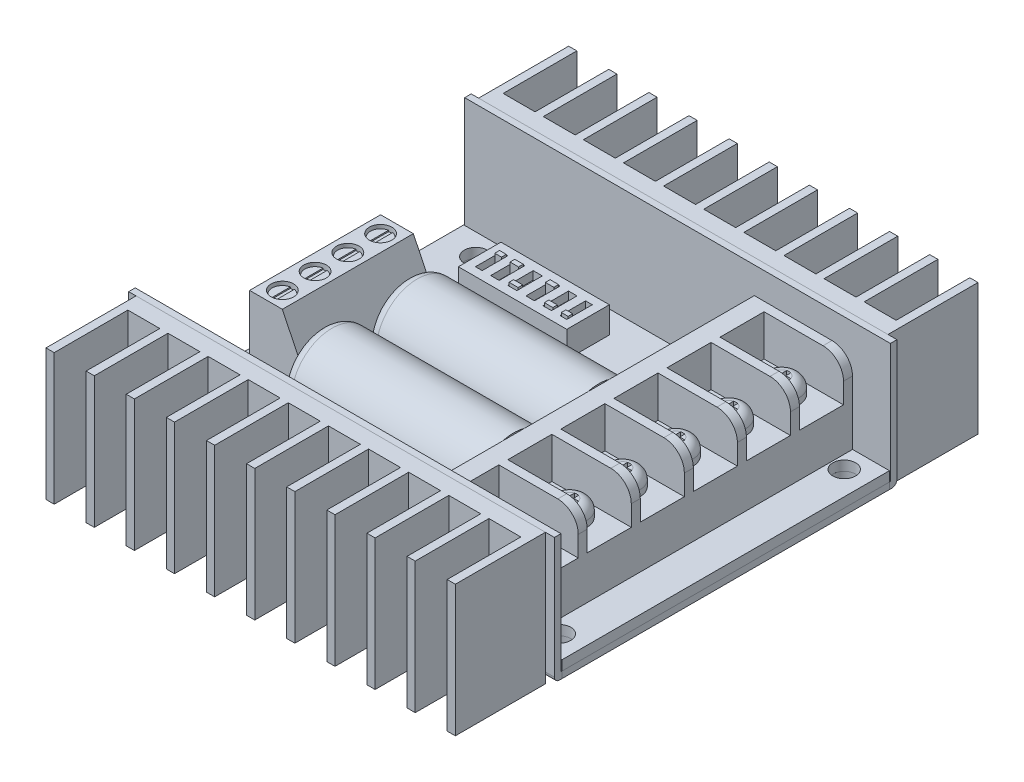
from build123d import *

# Parameters (mm, degrees)
SKETCH1_W              = 66.04
SKETCH1_H              = 50.8
BOSS_EXTRUDE1_DEPTH    = 0.762
SKETCH2_W              = 15.24
SKETCH2_H              = 50.8
BOSS_EXTRUDE2_DEPTH    = 6.6929
SKETCH7_W              = 2.921
SKETCH7_H              = 50.8
BOSS_EXTRUDE4_DEPTH    = 6.35
SKETCH8_W              = 1.397
SKETCH8_H              = 6.35
BOSS_EXTRUDE5_DEPTH    = 12.319
LPATTERN1_COUNT        = 4
LPATTERN1_PITCH        = 8.2296
LPATTERN2_COUNT        = 4
LPATTERN2_PITCH        = 8.2296
FILLET1_R              = 3.175
SKETCH9_W              = 8.509
SKETCH9_H              = 20.32
BOSS_EXTRUDE6_DEPTH    = 10.16
CHAMFER1_SIZE          = 7.112
CHAMFER1_SIZE2         = 3.429
SKETCH10_R             = 6.35
BOSS_EXTRUDE8_DEPTH    = 29.7434
SKETCH11_W             = 16.8148
SKETCH11_H             = 6.604
BOSS_EXTRUDE9_DEPTH    = 4.064
SKETCH12_W             = 1.047432025
SKETCH12_H             = 3.9624
SKETCH12_W_2           = 1.3208
SKETCH12_W_3           = 1.416367975
CUT_EXTRUDE1_DEPTH     = 1.27
SKETCH13_R             = 1.74625
CUT_EXTRUDE2_DEPTH     = 1.27
SKETCH14_R             = 3.2639
BOSS_EXTRUDE10_DEPTH   = 3.81
FILLET3_R              = 1.5875
SKETCH16_W             = 66.04
SKETCH16_H             = 50.8
BOSS_EXTRUDE11_DEPTH   = 1.016
BOSS_EXTRUDE12_DEPTH   = 66.04
FILLET4_R              = 0.09921875
FILLET5_R              = 0.79375
SKETCH18_W             = 63.5
SKETCH18_H             = 20.3708
BOSS_EXTRUDE13_DEPTH   = 2.54
SKETCH20_W             = 1.27
SKETCH20_H             = 11.43
BOSS_EXTRUDE14_DEPTH   = 20.3708
LPATTERN3_COUNT        = 11
LPATTERN3_PITCH        = 6.223
SKETCH21_R             = 1.778
CUT_EXTRUDE3_DEPTH     = 55.984494165
SKETCH22_R             = 2.7178
BOSS_EXTRUDE15_DEPTH   = 2.54
FILLET6_R              = 1.5875
CUT_EXTRUDE4_START     = -3.175
CUT_EXTRUDE4_DEPTH     = 3.175
LPATTERN4_COUNT        = 6
LPATTERN4_PITCH        = 8.2296
SKETCH24_W             = 1.047432025
SKETCH24_H             = 0.73841415
BOSS_EXTRUDE16_DEPTH   = 1.5875
SKETCH24_W_2           = 1.3208
BOSS_EXTRUDE16_2_DEPTH = 1.5875
SKETCH24_W_3           = 1.416367975
SKETCH24_H_2           = 0.710013606
BOSS_EXTRUDE16_3_DEPTH = 1.5875
BOSS_EXTRUDE16_4_DEPTH = 1.5875
BOSS_EXTRUDE16_5_DEPTH = 1.5875
BOSS_EXTRUDE16_6_DEPTH = 1.5875
SKETCH25_R             = 1.5875
BOSS_EXTRUDE17_DEPTH   = 0.79375
SKETCH26_W             = 0.635
SKETCH26_H             = 3.32829629
CUT_EXTRUDE5_DEPTH     = 0.1984375
LPATTERN5_COUNT        = 4
LPATTERN5_PITCH        = 5.08


# Read off the part's stored shape, not the designer's step: Cut-Extrude4
with BuildPart() as part:
    # Sketch1 → Boss-Extrude1 (new, symmetric)
    with BuildSketch(Plane(origin=(0, 0, 0), x_dir=(1, 0, 0), z_dir=(0, 1, 0))):
        Rectangle(SKETCH1_W, SKETCH1_H)
    extrude(amount=BOSS_EXTRUDE1_DEPTH, both=True)

    # Sketch9 → Boss-Extrude6 (add)
    with BuildSketch(Plane(origin=(0, 0.762, 0), x_dir=(1, 0, 0), z_dir=(0, 1, 0))):
        with Locations((-26.416, 0)):
            Rectangle(SKETCH9_W, SKETCH9_H)
    extrude(amount=BOSS_EXTRUDE6_DEPTH)

    # Chamfer1
    chamfer1_edges = [part.edges().sort_by_distance(p)[0] for p in [
        (-22.1615, 10.922, 0),
    ]]
    chamfer1_side = [part.faces().sort_by_distance(p)[0] for p in [
        (-22.1615, 5.842, 0),
    ]]
    chamfer(chamfer1_edges, length=CHAMFER1_SIZE, length2=CHAMFER1_SIZE2, reference=chamfer1_side[0])


with BuildPart() as body_2:
    # Sketch2 → Boss-Extrude2 (new body)
    with BuildSketch(Plane(origin=(0, 0.762, 0), x_dir=(1, 0, 0), z_dir=(0, 1, 0))):
        with Locations((19.685, 0)):
            Rectangle(SKETCH2_W, SKETCH2_H)
    extrude(amount=BOSS_EXTRUDE2_DEPTH)

    # Sketch7 → Boss-Extrude4 (add)
    with BuildSketch(Plane(origin=(0, 7.4549, 0), x_dir=(1, 0, 0), z_dir=(0, 1, 0))):
        with Locations((13.5255, 0)):
            Rectangle(SKETCH7_W, SKETCH7_H)
    extrude(amount=BOSS_EXTRUDE4_DEPTH)

    # Sketch8 → Boss-Extrude5 (add)
    with BuildSketch(Plane(origin=(14.986, 0, 0), x_dir=(0, 0, -1), z_dir=(1, 0, 0))):
        with Locations((0, 10.6299)):
            Rectangle(SKETCH8_W, SKETCH8_H)
    boss_extrude5 = extrude(amount=BOSS_EXTRUDE5_DEPTH)

    # LPattern1: Boss-Extrude5 ×4
    with Locations(*[(0, 0, i * LPATTERN1_PITCH) for i in range(1, LPATTERN1_COUNT)]):
        add(boss_extrude5)

    # LPattern2: Boss-Extrude5 ×4
    with Locations(*[(0, 0, -i * LPATTERN2_PITCH) for i in range(1, LPATTERN2_COUNT)]):
        add(boss_extrude5)

    # Fillet1
    fillet1_edges = [body_2.edges().sort_by_distance(p)[0] for p in [
        (27.305, 13.8049, -24.6888),
        (27.305, 13.8049, 0),
        (27.305, 13.8049, 8.2296),
        (27.305, 13.8049, 16.4592),
        (27.305, 13.8049, 24.6888),
        (27.305, 13.8049, -8.2296),
        (27.305, 13.8049, -16.4592),
    ]]
    fillet(fillet1_edges, radius=FILLET1_R)


    add(part.part)  # Boss-Extrude8 merges part
    # Sketch10 → Boss-Extrude8 (add)
    with BuildSketch(Plane.ZY.offset(-12.065)):
        with Locations(Location((11.938, 7.685002377, 0), (0, 0, 105.471469553))):
            Circle(SKETCH10_R)
        with Locations(Location((-1.27, 7.685002377, 0), (0, 0, 105.471469553))):
            Circle(SKETCH10_R)
    extrude(amount=BOSS_EXTRUDE8_DEPTH)

    # Sketch11 → Boss-Extrude9 (add)
    with BuildSketch(Plane(origin=(0, 0.762, 0), x_dir=(1, 0, 0), z_dir=(0, 1, 0))):
        with Locations((-15.3416, 18.6055)):
            Rectangle(SKETCH11_W, SKETCH11_H)
    extrude(amount=BOSS_EXTRUDE9_DEPTH)

    # Sketch12 → Cut-Extrude1 (cut)
    with BuildSketch(Plane(origin=(0, 4.826, 0), x_dir=(1, 0, 0), z_dir=(0, 1, 0))):
        with Locations((-21.904483988, 18.6055)):
            Rectangle(SKETCH12_W, SKETCH12_H)
        with Locations((-19.399567975, 18.6055)):
            Rectangle(SKETCH12_W_2, SKETCH12_H)
        with Locations((-16.710183988, 18.6055)):
            Rectangle(SKETCH12_W_3, SKETCH12_H)
        with Locations((-13.925232025, 18.6055)):
            Rectangle(SKETCH12_W_2, SKETCH12_H)
        with Locations((-11.283632025, 18.6055)):
            Rectangle(SKETCH12_W_2, SKETCH12_H)
        with Locations((-8.778716013, 18.6055)):
            Rectangle(SKETCH12_W, SKETCH12_H)
    extrude(amount=-CUT_EXTRUDE1_DEPTH, mode=Mode.SUBTRACT)

    # Sketch13 → Cut-Extrude2 (cut)
    with BuildSketch(Plane(origin=(0, 10.922, 0), x_dir=(1, 0, 0), z_dir=(0, 1, 0))):
        with Locations(Location((-28.1305, 7.62, 0), (0, 0, 270))):
            Circle(SKETCH13_R)
        with Locations(Location((-28.1305, 2.54, 0), (0, 0, 270))):
            Circle(SKETCH13_R)
        with Locations(Location((-28.1305, -2.54, 0), (0, 0, 270))):
            Circle(SKETCH13_R)
        with Locations(Location((-28.1305, -7.62, 0), (0, 0, 270))):
            Circle(SKETCH13_R)
    extrude(amount=-CUT_EXTRUDE2_DEPTH, mode=Mode.SUBTRACT)

    # Sketch14 → Boss-Extrude10 (add)
    with BuildSketch(Plane(origin=(0, 0.762, 0), x_dir=(1, 0, 0), z_dir=(0, 1, 0))):
        with Locations(Location((-22.1361, -20.7264, 0), (0, 0, 90))):
            Circle(SKETCH14_R)
        with Locations(Location((-14.1859, -20.7264, 0), (0, 0, 90))):
            Circle(SKETCH14_R)
    extrude(amount=BOSS_EXTRUDE10_DEPTH)

    # Fillet3
    fillet3_edges = [body_2.edges().sort_by_distance(p)[0] for p in [
        (-17.6784, 1.565104755, 13.631916494),
        (-17.6784, 1.565104755, 0.423916494),
    ]]
    fillet(fillet3_edges, radius=FILLET3_R)


with BuildPart() as body_2_2:
    # Sketch16 → Boss-Extrude11 (new body)
    with BuildSketch(Plane.XZ.offset(0.762)):
        Rectangle(SKETCH16_W, SKETCH16_H)
    extrude(amount=BOSS_EXTRUDE11_DEPTH)


with BuildPart() as body_3:
    # Sketch17 → Boss-Extrude12 (new body)
    with BuildSketch(Plane.ZY.offset(33.02)):
        Polygon((25.5524, 17.78), (25.5524, -0.762), (25.4, -0.762), (25.4, -1.778), (26.5684, -1.778), (26.5684, 17.78), align=None)
    extrude(amount=-BOSS_EXTRUDE12_DEPTH)

    # Fillet4
    fillet4_edges = [body_3.edges().sort_by_distance(p)[0] for p in [
        (0, -0.762, 25.5524),
    ]]
    fillet(fillet4_edges, radius=FILLET4_R)

    # Fillet5
    fillet5_edges = [body_3.edges().sort_by_distance(p)[0] for p in [
        (0, -1.778, 26.5684),
    ]]
    fillet(fillet5_edges, radius=FILLET5_R)


with BuildPart() as body_4:
    # Mirror5: mirrored copy
    add(body_3.part.mirror(Plane.XY))


with BuildPart() as body_5:
    # Sketch18 → Boss-Extrude13 (new body)
    with BuildSketch(Plane.XY.offset(26.5684)):
        with Locations((-0.127, 7.5946)):
            Rectangle(SKETCH18_W, SKETCH18_H)
    extrude(amount=BOSS_EXTRUDE13_DEPTH)

    # Sketch20 → Boss-Extrude14 (add)
    with BuildSketch(Plane(origin=(0, 17.78, 0), x_dir=(1, 0, 0), z_dir=(0, 1, 0))):
        with Locations((-31.242, -34.8234)):
            Rectangle(SKETCH20_W, SKETCH20_H)
    boss_extrude14 = extrude(amount=-BOSS_EXTRUDE14_DEPTH)

    # LPattern3: Boss-Extrude14 ×11
    with Locations(*[(i * LPATTERN3_PITCH, 0, 0) for i in range(1, LPATTERN3_COUNT)]):
        add(boss_extrude14)


with BuildPart() as body_6:
    # Mirror6: mirrored copy
    add(body_5.part.mirror(Plane.XY))


with BuildPart() as cut_extrude3_tool:
    # Sketch21 → Cut-Extrude3 (new, through all)
    with BuildSketch(Plane(origin=(0, 0.762, 0), x_dir=(1, 0, 0), z_dir=(0, 1, 0))):
        with Locations(Location((-27.813, 22.0726, 0), (0, 0, 270))):
            Circle(SKETCH21_R)
        with Locations(Location((-27.813, -22.1234, 0), (0, 0, 270))):
            Circle(SKETCH21_R)
        with Locations(Location((29.337, -22.1234, 0), (0, 0, 270))):
            Circle(SKETCH21_R)
        with Locations(Location((29.337, 22.0726, 0), (0, 0, 270))):
            Circle(SKETCH21_R)
    extrude(amount=-CUT_EXTRUDE3_DEPTH)


with BuildPart() as body_2_1:
    add(body_2.part)

    # Cut-Extrude3: cut by cut_extrude3_tool
    add(cut_extrude3_tool.part, mode=Mode.SUBTRACT)

    # Sketch22 → Boss-Extrude15 (add)
    with BuildSketch(Plane(origin=(0, 7.4549, 0), x_dir=(1, 0, 0), z_dir=(0, 1, 0))):
        with Locations(Location((21.1455, 20.574, 0), (0, 0, 270))):
            Circle(SKETCH22_R)
        with Locations(Location((21.1455, 12.3444, 0), (0, 0, 270))):
            Circle(SKETCH22_R)
        with Locations(Location((21.1455, 4.1148, 0), (0, 0, 270))):
            Circle(SKETCH22_R)
        with Locations(Location((21.1455, -4.1148, 0), (0, 0, 270))):
            Circle(SKETCH22_R)
        with Locations(Location((21.1455, -12.3444, 0), (0, 0, 270))):
            Circle(SKETCH22_R)
        with Locations(Location((21.1455, -20.574, 0), (0, 0, 270))):
            Circle(SKETCH22_R)
    extrude(amount=BOSS_EXTRUDE15_DEPTH)

    # Fillet6
    fillet6_edges = [body_2_1.edges().sort_by_distance(p)[0] for p in [
        (21.1455, 9.9949, -23.2918),
        (21.1455, 9.9949, -15.0622),
        (21.1455, 9.9949, -6.8326),
        (21.1455, 9.9949, 1.397),
        (21.1455, 9.9949, 9.6266),
        (21.1455, 9.9949, 17.8562),
    ]]
    fillet(fillet6_edges, radius=FILLET6_R)

    # Cut-Extrude4 outline → Cut-Extrude4 (cut)
    with BuildSketch(Plane(origin=(0, 9.9949, 0), x_dir=(1, 0, 0), z_dir=(0, 1, 0)).offset(CUT_EXTRUDE4_START)):
        with BuildLine():
            ThreePointArc((21.463, -19.48920885), (21.1455, -19.4437), (20.828, -19.48920885))
            Line((20.828, -19.48920885), (20.828, -20.2565))
            Line((20.828, -20.2565), (20.06070885, -20.2565))
            ThreePointArc((20.06070885, -20.2565), (20.0152, -20.574), (20.06070885, -20.8915))
            Line((20.06070885, -20.8915), (20.828, -20.8915))
            Line((20.828, -20.8915), (20.828, -21.65879115))
            ThreePointArc((20.828, -21.65879115), (21.1455, -21.7043), (21.463, -21.65879115))
            Line((21.463, -21.65879115), (21.463, -20.8915))
            Line((21.463, -20.8915), (22.23029115, -20.8915))
            ThreePointArc((22.23029115, -20.8915), (22.2758, -20.574), (22.23029115, -20.2565))
            Line((22.23029115, -20.2565), (21.463, -20.2565))
            Line((21.463, -20.2565), (21.463, -19.48920885))
        make_face()
    cut_extrude4 = extrude(amount=CUT_EXTRUDE4_DEPTH, mode=Mode.SUBTRACT)

    # LPattern4: Cut-Extrude4 ×6
    with Locations(*[(0, 0, -i * LPATTERN4_PITCH) for i in range(1, LPATTERN4_COUNT)]):
        add(cut_extrude4, mode=Mode.SUBTRACT)

    # Sketch25 → Boss-Extrude17 (add)
    with BuildSketch(Plane(origin=(0, 9.652, 0), x_dir=(1, 0, 0), z_dir=(0, 1, 0))):
        with Locations(Location((-28.1305, 7.62, 0), (0, 0, 270))):
            Circle(SKETCH25_R)
    boss_extrude17 = extrude(amount=BOSS_EXTRUDE17_DEPTH)

    # Sketch26 → Cut-Extrude5 (cut)
    with BuildSketch(Plane(origin=(0, 10.44575, 0), x_dir=(1, 0, 0), z_dir=(0, 1, 0))):
        with Locations((-28.1305, 7.62)):
            Rectangle(SKETCH26_W, SKETCH26_H)
    cut_extrude5 = extrude(amount=-CUT_EXTRUDE5_DEPTH, mode=Mode.SUBTRACT)

    # LPattern5: Boss-Extrude17, Cut-Extrude5 ×4
    with Locations(*[(0, 0, i * LPATTERN5_PITCH) for i in range(1, LPATTERN5_COUNT)]):
        add(boss_extrude17)
        add(cut_extrude5, mode=Mode.SUBTRACT)


with BuildPart() as body_2_2_1:
    add(body_2_2.part)

    # Cut-Extrude3: cut by cut_extrude3_tool
    add(cut_extrude3_tool.part, mode=Mode.SUBTRACT)


with BuildPart() as body_7:
    # Sketch24 → Boss-Extrude16 (new body)
    with BuildSketch(Plane(origin=(0, 3.556, 0), x_dir=(1, 0, 0), z_dir=(0, 1, 0))):
        with Locations((-21.904483988, 19.996582999)):
            Rectangle(SKETCH24_W, SKETCH24_H)
    extrude(amount=BOSS_EXTRUDE16_DEPTH)


with BuildPart() as body_8:
    # Sketch24 → Boss-Extrude16 2 (new body)
    with BuildSketch(Plane(origin=(0, 3.556, 0), x_dir=(1, 0, 0), z_dir=(0, 1, 0))):
        with Locations((-19.399567975, 19.996582999)):
            Rectangle(SKETCH24_W_2, SKETCH24_H)
    extrude(amount=BOSS_EXTRUDE16_2_DEPTH)


with BuildPart() as body_9:
    # Sketch24 → Boss-Extrude16 3 (new body)
    with BuildSketch(Plane(origin=(0, 3.556, 0), x_dir=(1, 0, 0), z_dir=(0, 1, 0))):
        with Locations((-16.710183988, 17.184929122)):
            Rectangle(SKETCH24_W_3, SKETCH24_H_2)
    extrude(amount=BOSS_EXTRUDE16_3_DEPTH)


with BuildPart() as body_10:
    # Sketch24 → Boss-Extrude16 4 (new body)
    with BuildSketch(Plane(origin=(0, 3.556, 0), x_dir=(1, 0, 0), z_dir=(0, 1, 0))):
        with Locations((-13.925232025, 19.996582999)):
            Rectangle(SKETCH24_W_2, SKETCH24_H)
    extrude(amount=BOSS_EXTRUDE16_4_DEPTH)


with BuildPart() as body_11:
    # Sketch24 → Boss-Extrude16 5 (new body)
    with BuildSketch(Plane(origin=(0, 3.556, 0), x_dir=(1, 0, 0), z_dir=(0, 1, 0))):
        with Locations((-11.283632025, 17.184929122)):
            Rectangle(SKETCH24_W_2, SKETCH24_H_2)
    extrude(amount=BOSS_EXTRUDE16_5_DEPTH)


with BuildPart() as body_12:
    # Sketch24 → Boss-Extrude16 6 (new body)
    with BuildSketch(Plane(origin=(0, 3.556, 0), x_dir=(1, 0, 0), z_dir=(0, 1, 0))):
        with Locations((-8.778716013, 17.184929122)):
            Rectangle(SKETCH24_W, SKETCH24_H_2)
    extrude(amount=BOSS_EXTRUDE16_6_DEPTH)


solid = Compound([body_3.part, body_4.part, body_5.part, body_6.part, body_2_1.part, body_2_2_1.part, body_7.part, body_8.part, body_9.part, body_10.part, body_11.part, body_12.part])
